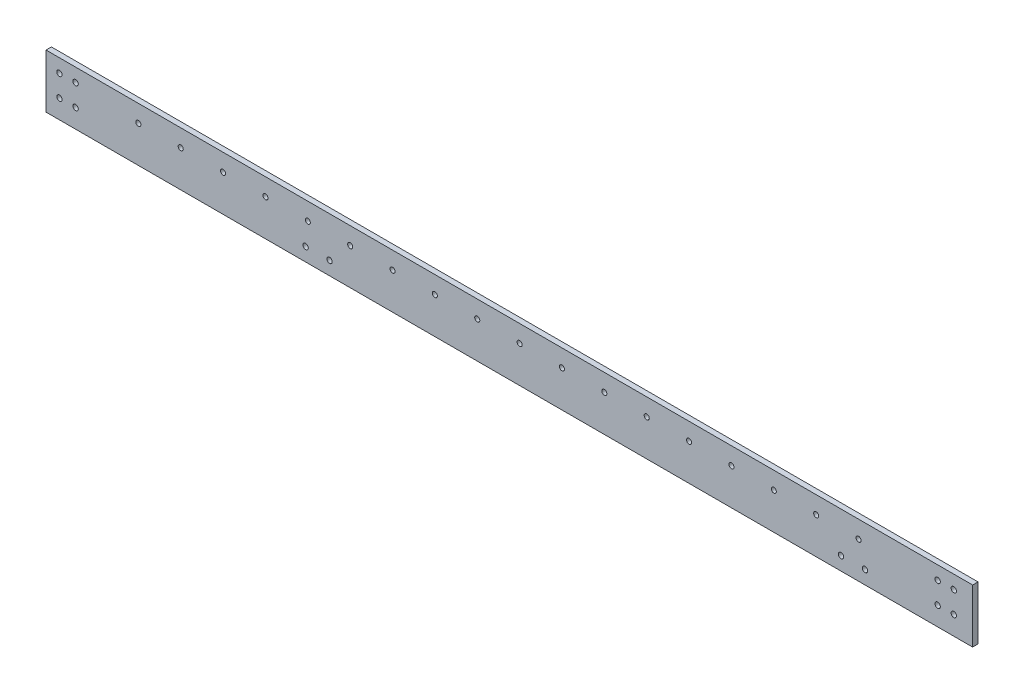
from build123d import *

# Parameters (mm, degrees)
SKETCH1_W                    = 3.175
SKETCH1_H                    = 31.75
BOSS_EXTRUDE1_DEPTH          = 546.825
SIDEHOLES_SKETCH4_R          = 1.5875
SIDEHOLES_SKETCH4_R_2        = 1.5
SIDEHOLES_CUT_EXTRUDE3_DEPTH = 548.755167707


with BuildPart() as part:
    # Sketch1 → Boss-Extrude1 (new body)
    with BuildSketch(Plane(origin=(0, 0, 0), x_dir=(0, 0, -1), z_dir=(1, 0, 0))):
        with Locations((-1.5875, 15.875)):
            Rectangle(SKETCH1_W, SKETCH1_H)
    extrude(amount=BOSS_EXTRUDE1_DEPTH)

    # SideHoles-Sketch4 → SideHoles-Cut-Extrude3 (cut, through all)
    with BuildSketch(Plane.XY.offset(3.175)):
        with Locations((7.9375, 23.8125)):
            Circle(SIDEHOLES_SKETCH4_R)
        with Locations((526.1875, 23.8125)):
            Circle(SIDEHOLES_SKETCH4_R)
        with Locations((17.4625, 23.8125)):
            Circle(SIDEHOLES_SKETCH4_R)
        with Locations((535.7125, 23.8125)):
            Circle(SIDEHOLES_SKETCH4_R)
        with Locations((7.9375, 11.1125)):
            Circle(SIDEHOLES_SKETCH4_R)
        with Locations((17.4625, 11.1125)):
            Circle(SIDEHOLES_SKETCH4_R)
        with Locations((526.1875, 11.1125)):
            Circle(SIDEHOLES_SKETCH4_R)
        with Locations((535.7125, 11.1125)):
            Circle(SIDEHOLES_SKETCH4_R)
        with Locations((54.5, 21.525)):
            Circle(SIDEHOLES_SKETCH4_R_2)
        with Locations((79.5, 21.525)):
            Circle(SIDEHOLES_SKETCH4_R_2)
        with Locations((104.5, 21.525)):
            Circle(SIDEHOLES_SKETCH4_R_2)
        with Locations((129.5, 21.525)):
            Circle(SIDEHOLES_SKETCH4_R_2)
        with Locations((154.5, 21.525)):
            Circle(SIDEHOLES_SKETCH4_R_2)
        with Locations((179.5, 21.525)):
            Circle(SIDEHOLES_SKETCH4_R_2)
        with Locations((204.5, 21.525)):
            Circle(SIDEHOLES_SKETCH4_R_2)
        with Locations((229.5, 21.525)):
            Circle(SIDEHOLES_SKETCH4_R_2)
        with Locations((254.5, 21.525)):
            Circle(SIDEHOLES_SKETCH4_R_2)
        with Locations((279.5, 21.525)):
            Circle(SIDEHOLES_SKETCH4_R_2)
        with Locations((304.5, 21.525)):
            Circle(SIDEHOLES_SKETCH4_R_2)
        with Locations((329.5, 21.525)):
            Circle(SIDEHOLES_SKETCH4_R_2)
        with Locations((354.5, 21.525)):
            Circle(SIDEHOLES_SKETCH4_R_2)
        with Locations((379.5, 21.525)):
            Circle(SIDEHOLES_SKETCH4_R_2)
        with Locations((469.1875, 7.9375)):
            Circle(SIDEHOLES_SKETCH4_R)
        with Locations((483.3125, 7.9375)):
            Circle(SIDEHOLES_SKETCH4_R)
        with Locations((153.1875, 7.9375)):
            Circle(SIDEHOLES_SKETCH4_R)
        with Locations((167.3125, 7.9375)):
            Circle(SIDEHOLES_SKETCH4_R)
        with Locations((404.5, 21.525)):
            Circle(SIDEHOLES_SKETCH4_R_2)
        with Locations((429.5, 21.525)):
            Circle(SIDEHOLES_SKETCH4_R_2)
        with Locations((454.5, 21.525)):
            Circle(SIDEHOLES_SKETCH4_R_2)
        with Locations((479.5, 21.525)):
            Circle(SIDEHOLES_SKETCH4_R_2)
    extrude(amount=-SIDEHOLES_CUT_EXTRUDE3_DEPTH, mode=Mode.SUBTRACT)


solid = part.part
